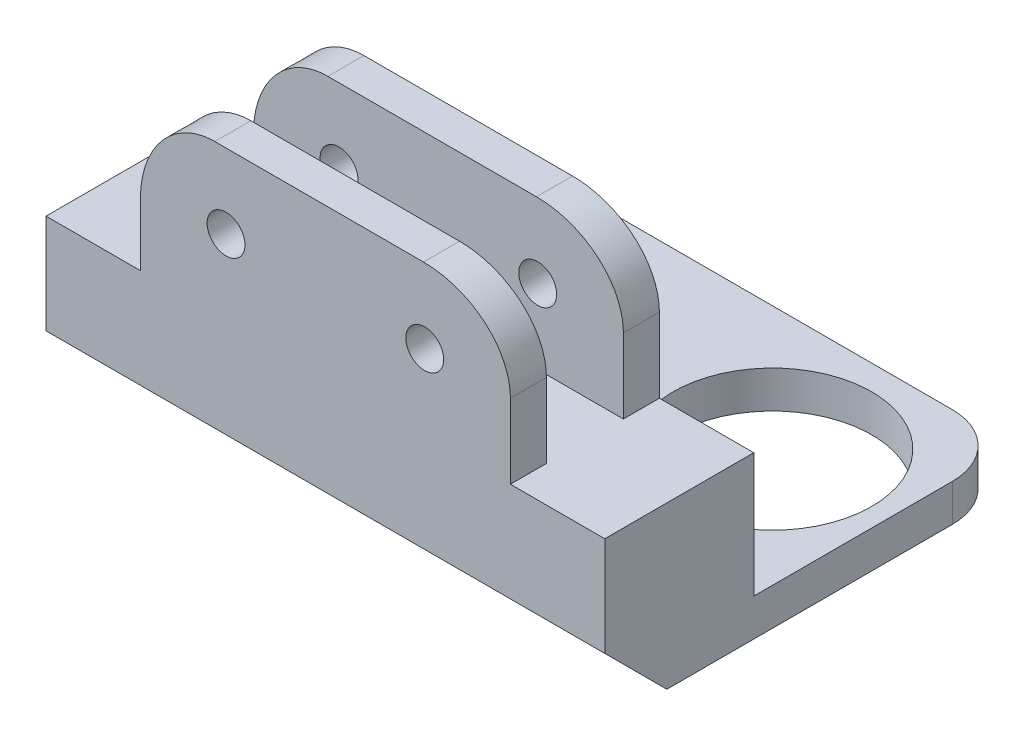
from build123d import *

# Parameters (mm, degrees)
SKETCH1_W           = 45
SKETCH1_H           = 20
SKETCH1_R           = 8
SKETCH1_H_2         = 13
SKETCH1_H_3         = 1
BOSS_EXTRUDE1_DEPTH = 3
SKETCH3_W           = 45
SKETCH3_H           = 2.9
SKETCH3_H_2         = 6.2
BOSS_EXTRUDE2_DEPTH = 10
SKETCH3_3_W         = 45
SKETCH3_3_H         = 2.9
BOSS_EXTRUDE3_DEPTH = 22
SKETCH6_R           = 1.525
SKETCH6_W           = 7.6
SKETCH6_H           = 12
CUT_EXTRUDE2_DEPTH  = 16.5
CHAMFER1_SIZE       = 5
FILLET2_R           = 5
FILLET3_SIZE        = 7
FILLET3_SIZE_2      = 6


with BuildPart() as part:
    # Sketch1 → Boss-Extrude1 (new body)
    # profile 1 of 3: a face of its own
    with BuildSketch(Plane(origin=(0, 0, 0), x_dir=(1, 0, 0), z_dir=(0, 1, 0))):
        Rectangle(SKETCH1_W, SKETCH1_H)
        with Locations(Location((13, 0, 0), (0, 0, 270))):
            Circle(SKETCH1_R, mode=Mode.SUBTRACT)
        with Locations(Location((-13, 0, 0), (0, 0, 270))):
            Circle(SKETCH1_R, mode=Mode.SUBTRACT)
    # profile 2 of 3: a face of its own
    with BuildSketch(Plane(origin=(0, 0, 0), x_dir=(1, 0, 0), z_dir=(0, 1, 0))):
        with Locations((0, -16.5)):
            Rectangle(SKETCH1_W, SKETCH1_H_2)
    # profile 3 of 3: a face of its own
    with BuildSketch(Plane(origin=(0, 0, 0), x_dir=(1, 0, 0), z_dir=(0, 1, 0))):
        with Locations((0, -10.5)):
            Rectangle(SKETCH1_W, SKETCH1_H_3)
    extrude(amount=BOSS_EXTRUDE1_DEPTH)

    # Sketch3 → Boss-Extrude2 (add)
    with BuildSketch(Plane(origin=(0, 3, 0), x_dir=(1, 0, 0), z_dir=(0, 1, 0))):
        with Locations((0, -21.55)):
            Rectangle(SKETCH3_W, SKETCH3_H)
        with Locations((0, -17)):
            Rectangle(SKETCH3_W, SKETCH3_H_2)
        with Locations((0, -12.45)):
            Rectangle(SKETCH3_W, SKETCH3_H)
    extrude(amount=BOSS_EXTRUDE2_DEPTH)

    # Sketch3<3> → Boss-Extrude3 (add)
    with BuildSketch(Plane(origin=(0, 3, 0), x_dir=(1, 0, 0), z_dir=(0, 1, 0))):
        with Locations((0, -12.45)):
            Rectangle(SKETCH3_3_W, SKETCH3_3_H)
        with Locations((0, -21.55)):
            Rectangle(SKETCH3_3_W, SKETCH3_3_H)
    extrude(amount=BOSS_EXTRUDE3_DEPTH)

    # Sketch6 → Cut-Extrude2 (cut)
    with BuildSketch(Plane(origin=(0, 0, 11), x_dir=(-1, 0, 0), z_dir=(0, 0, -1))):
        with Locations((-8, 19)):
            Circle(SKETCH6_R)
        with Locations((8, 19)):
            Circle(SKETCH6_R)
        with Locations((-18.7, 19)):
            Rectangle(SKETCH6_W, SKETCH6_H)
        with Locations((18.7, 19)):
            Rectangle(SKETCH6_W, SKETCH6_H)
    extrude(amount=-CUT_EXTRUDE2_DEPTH, mode=Mode.SUBTRACT)

    # Chamfer1
    chamfer1_edges = [part.edges().sort_by_distance(p)[0] for p in [
        (0, 0, 23),
    ]]
    chamfer(chamfer1_edges, length=CHAMFER1_SIZE)

    # Fillet2
    fillet2_edges = [part.edges().sort_by_distance(p)[0] for p in [
        (-22.5, 1.5, -10),
        (22.5, 1.5, -10),
    ]]
    fillet(fillet2_edges, radius=FILLET2_R)

    # Fillet3
    # an asymmetric fillet: 7, 6 mm, written as the material it takes off along each edge
    with BuildSketch(Plane(origin=(14.9, 25, -6.5), x_dir=(-1, 0, 0), z_dir=(0, 0, 1)), Plane(origin=(-14.9, 25, -6.5), x_dir=(0, -1, 0), z_dir=(0, 0, 1))) as fillet3_piece_1:
        with BuildLine():
            Bezier((FILLET3_SIZE, 0), (0, 0), (0, FILLET3_SIZE_2), weights=[1, 0.707106781, 1])
            Line((0, FILLET3_SIZE_2), (0, 0))
            Line((0, 0), (FILLET3_SIZE, 0))
        make_face()
    extrude(amount=37.9, mode=Mode.SUBTRACT)
    with BuildSketch(Plane(origin=(14.9, 25, 2.6), x_dir=(0, -1, 0), z_dir=(0, 0, 1)), Plane(origin=(-14.9, 25, 2.6), x_dir=(1, 0, 0), z_dir=(0, 0, 1))) as fillet3_piece_2:
        with BuildLine():
            Bezier((FILLET3_SIZE_2, 0), (0, 0), (0, -FILLET3_SIZE), weights=[1, 0.707106781, 1])
            Line((0, -FILLET3_SIZE), (0, 0))
            Line((0, 0), (FILLET3_SIZE_2, 0))
        make_face()
    extrude(amount=37.9, mode=Mode.SUBTRACT)


solid = part.part
